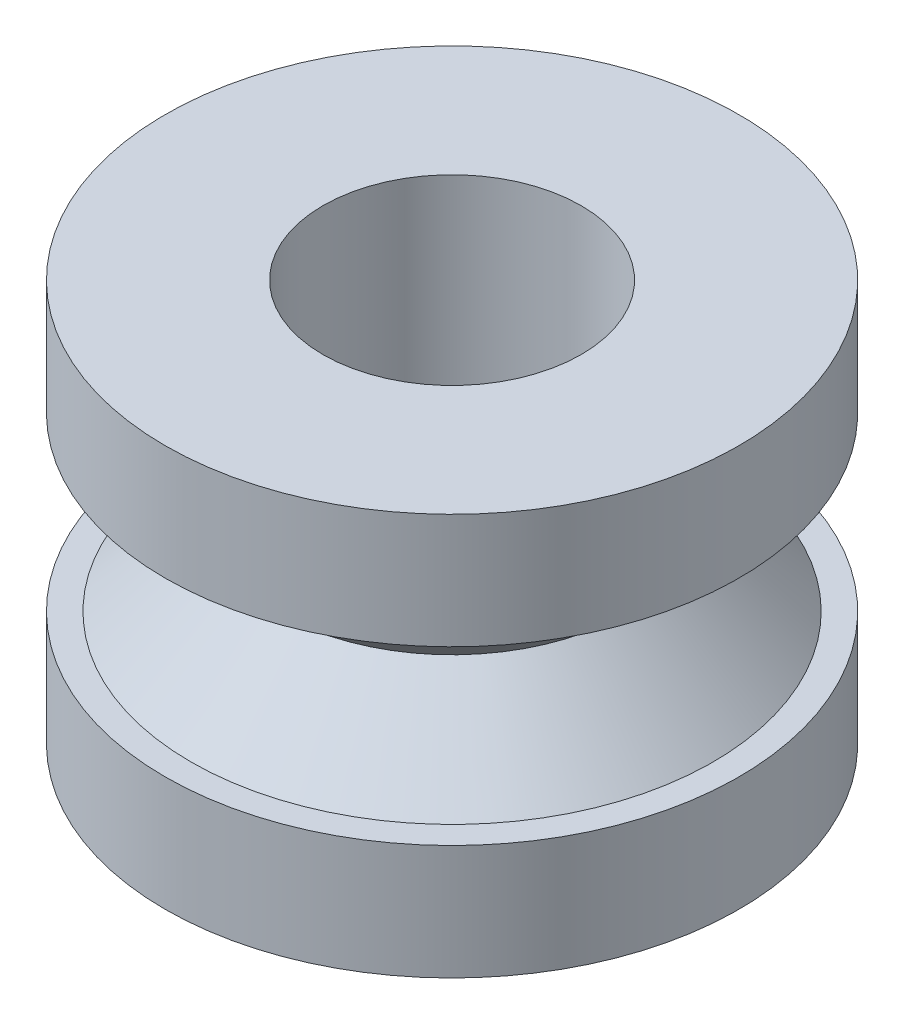
from build123d import *

# Parameters (mm, degrees)
SKETCH_1_R      = 3.05
SKETCH_1_R_2    = 2.25
EXTRUDE_1_DEPTH = 7
SKETCH_2_R      = 5
SKETCH_2_R_2    = 2.25
EXTRUDE_2_DEPTH = 2
EXTRUDE_START   = -2
SKETCH_3_R      = 5
SKETCH_3_R_2    = 2.25
EXTRUDE_3_DEPTH = 2
CHAMFER_1_SIZE  = 1.5


with BuildPart() as part:
    # Эскиз1 → Вытянуть-Тонкостенный1 (new body)
    with BuildSketch(Plane(origin=(0, 0, 0), x_dir=(1, 0, 0), z_dir=(0, 1, 0))):
        Circle(SKETCH_1_R)
        Circle(SKETCH_1_R_2, mode=Mode.SUBTRACT)
    extrude(amount=EXTRUDE_1_DEPTH)

    # Эскиз2 → Вытянуть-Тонкостенный2 (add)
    with BuildSketch(Plane(origin=(0, 0, 0), x_dir=(1, 0, 0), z_dir=(0, 1, 0))):
        Circle(SKETCH_2_R)
        Circle(SKETCH_2_R_2, mode=Mode.SUBTRACT)
    extrude(amount=EXTRUDE_2_DEPTH)

    # Эскиз3 → Вытянуть-Тонкостенный3 (add)
    with BuildSketch(Plane(origin=(0, 7, 0), x_dir=(1, 0, 0), z_dir=(0, 1, 0)).offset(EXTRUDE_START)):
        Circle(SKETCH_3_R)
        Circle(SKETCH_3_R_2, mode=Mode.SUBTRACT)
    extrude(amount=EXTRUDE_3_DEPTH)

    # Фаска1
    chamfer_1_edges = [part.edges().sort_by_distance(p)[0] for p in [
        (-3.05, 2, 0),
        (-3.05, 5, 0),
    ]]
    chamfer(chamfer_1_edges, length=CHAMFER_1_SIZE - 0.0001)  # a hair under: the kernel refuses the full size


solid = part.part
